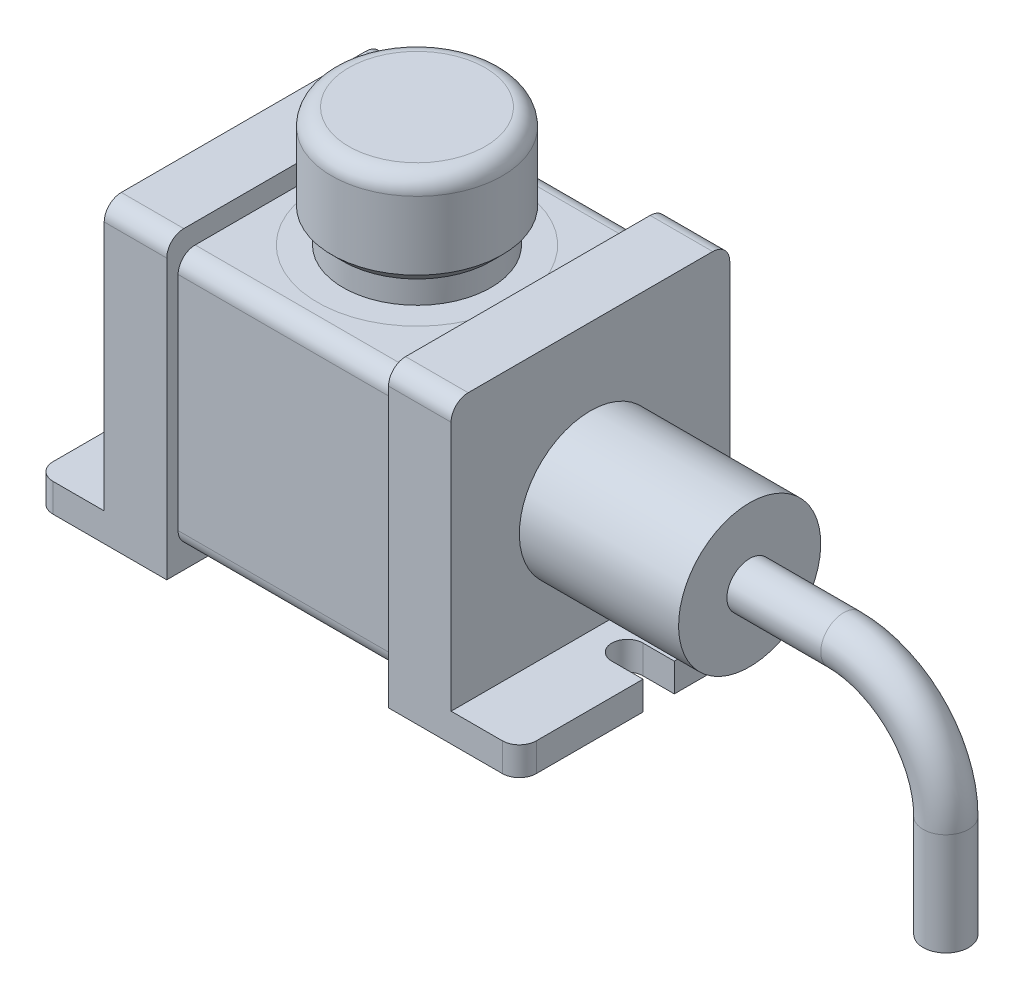
from build123d import *

# Parameters (mm, degrees)
SKETCH_1_W          = 45
SKETCH_1_H          = 45
EXTRUDE_1_DEPTH     = 22.5
EXTRUDE_2_DEPTH     = 24.5
CUT_EXTRUDE_1_DEPTH = 72.48776119
CHAMFER_1_SIZE      = 2
FILLET_1_R          = 3
FILLET_2_R          = 3
SKETCH_5_R          = 12.5
EXTRUDE_3_DEPTH     = 28
SKETCH_6_R          = 4


with BuildPart() as part:
    # ｽｹｯﾁ1 → ﾎﾞｽ - 押し出し1 (new, symmetric)
    with BuildSketch(Plane.XY):
        Rectangle(SKETCH_1_W, SKETCH_1_H)
    extrude(amount=EXTRUDE_1_DEPTH, both=True)

    # ｽｹｯﾁ2 → ﾎﾞｽ - 押し出し2 (add, symmetric)
    with BuildSketch(Plane.XY):
        Polygon((-19.5, -26), (-42.5, -26), (-42.5, -21), (-30.5, -21), (-30.5, 26), (-19.5, 26), align=None)
    extrude_2 = extrude(amount=EXTRUDE_2_DEPTH, both=True)

    # ｽｹｯﾁ3 → ｶｯﾄ - 押し出し1 (cut, symmetric)
    with BuildSketch(Plane.XZ.offset(26)):
        with BuildLine():
            Line((-42.5, -2.75), (-42.5, 2.75))
            Line((-42.5, 2.75), (-37, 2.75))
            ThreePointArc((-37, 2.75), (-34.25, 0), (-37, -2.75))
            Line((-37, -2.75), (-42.5, -2.75))
        make_face()
    cut_extrude_1 = extrude(amount=CUT_EXTRUDE_1_DEPTH, both=True, mode=Mode.SUBTRACT)

    # ｽｹｯﾁ4 → 回転1 (revolve)
    with BuildSketch(Plane.XY, mode=Mode.PRIVATE) as revolve_1_sk:
        Polygon((0, 43.5), (-15, 43.5), (-15, 28.5), (-13, 28.5), (-13, 22.5), (0, 22.5), align=None)
    revolve(revolve_1_sk.sketch.rotate(Axis((0, 0, 0), (0, 1, 0)), 270), axis=Axis((0, 0, 0), (0, 1, 0)))

    # 面取り1
    chamfer_1_edges = [part.edges().sort_by_distance(p)[0] for p in [
        (0, 28.5, 13),
    ]]
    chamfer(chamfer_1_edges, length=CHAMFER_1_SIZE - 0.0001)  # a hair under: the kernel refuses the full size

    # ﾌｨﾚｯﾄ1
    fillet_1_edges = [part.edges().sort_by_distance(p)[0] for p in [
        (0, 43.5, 15),
    ]]
    fillet(fillet_1_edges, radius=FILLET_1_R)

    # ﾐﾗｰ1: ﾎﾞｽ - 押し出し2, ｶｯﾄ - 押し出し1 across plane
    add(extrude_2.mirror(Plane(origin=(0, 0, 0), x_dir=(0, 0, 1), z_dir=(1, 0, 0))))
    add(cut_extrude_1.mirror(Plane(origin=(0, 0, 0), x_dir=(0, 0, 1), z_dir=(1, 0, 0))), mode=Mode.SUBTRACT)

    # ﾌｨﾚｯﾄ2
    fillet_2_edges = [part.edges().sort_by_distance(p)[0] for p in [
        (0, -22.5, -22.5),
        (0, -22.5, 22.5),
        (-25, 26, -24.5),
        (-42.5, -23.5, -24.5),
        (-25, 26, 24.5),
        (-42.5, -23.5, 24.5),
        (0, 22.5, -22.5),
        (0, 22.5, 22.5),
        (42.5, -23.5, 24.5),
        (25, 26, 24.5),
        (25, 26, -24.5),
        (42.5, -23.5, -24.5),
    ]]
    fillet(fillet_2_edges, radius=FILLET_2_R)

    # ｽｹｯﾁ5 → ﾎﾞｽ - 押し出し3 (add)
    with BuildSketch(Plane(origin=(30.5, 0, 0), x_dir=(0, 0, -1), z_dir=(1, 0, 0))):
        with Locations(Location((0, 0, 0), (0, 0, 90))):
            Circle(SKETCH_5_R)
    extrude(amount=EXTRUDE_3_DEPTH)

    # ｽｲｰﾌﾟ1: sweep along a path in ｽｹｯﾁ9
    with BuildLine(Plane.XY) as sweep_1_path:
        Line((58.5, 0), (75, 0))
        ThreePointArc((75, 0), (87.727922061, -5.272077939), (93, -18))
        Line((93, -18), (93, -36))
    # ｽｹｯﾁ6 → ｽｲｰﾌﾟ1 (sweep)
    with BuildSketch(Plane(origin=(58.5, 0, 0), x_dir=(0, 0, -1), z_dir=(1, 0, 0))):
        Circle(SKETCH_6_R)
    sweep(path=sweep_1_path.line)


solid = part.part
